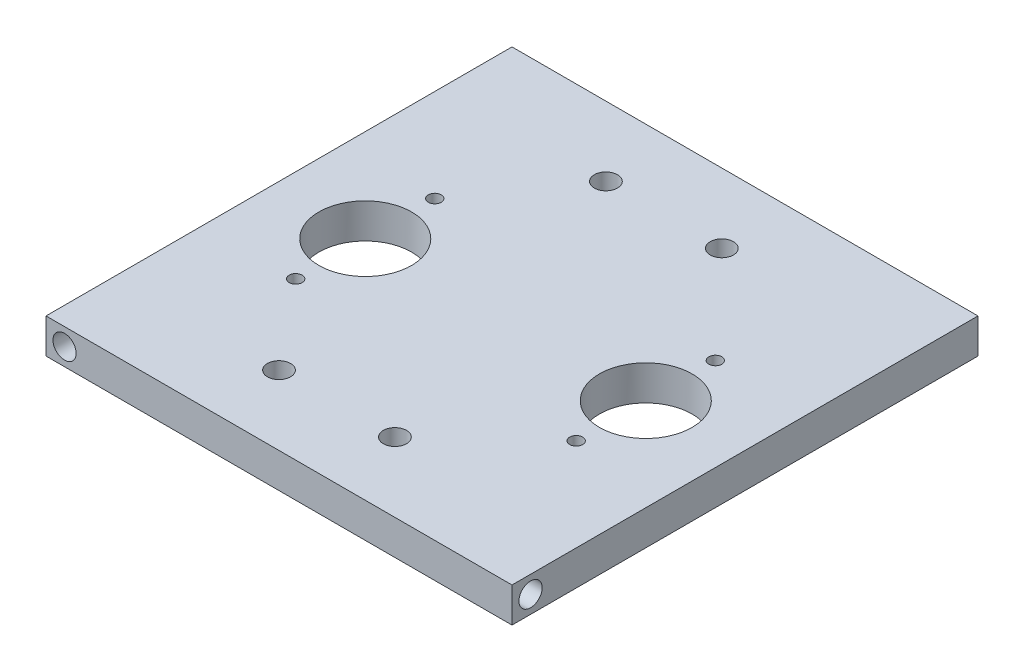
from build123d import *

# Parameters (mm, degrees)
SKETCH1_W                      = 127.635
SKETCH1_H                      = 127.635
MAIN_PLATE_DEPTH               = 9.525
SKETCH2_R                      = 3.175
U_BOLT_HOLE_DEPTH              = 12.7
U_BOLT_PATTERN_COUNT           = 2
U_BOLT_PATTERN_PITCH           = 31.75
U_BOLT_PATTERN_COUNT_DIR2      = 2
U_BOLT_PATTERN_PITCH_DIR2      = 89.535
SKETCH3_R                      = 1.778
RAPTOR_BOLT_HOLE_DEPTH         = 12.7
RAPTOR_BOLT_PATTERN_COUNT      = 2
RAPTOR_BOLT_PATTERN_PITCH      = 38.1
RAPTOR_BOLT_PATTERN_COUNT_DIR2 = 2
RAPTOR_BOLT_PATTERN_PITCH_DIR2 = 76.835
SKETCH4_R                      = 12.7
CO2_CYLINDER_HOLE_DEPTH        = 12.7
CO2_PATTERN_COUNT              = 2
CO2_PATTERN_PITCH              = 76.835
SKETCH5_R                      = 3.175
FRAME_ATTACHMENT_HOLE_1_DEPTH  = 12.7
SKETCH6_R                      = 3.175
FRAME_ATTACHMENT_HOLE_2_DEPTH  = 12.7
SKETCH7_R                      = 3.175
FRAME_ATTACHMENT_HOLE_3_DEPTH  = 12.7
SKETCH8_R                      = 3.175
FRAME_ATTACHMENT_HOLE_4_DEPTH  = 12.7


with BuildPart() as part:
    # Sketch1 → Main Plate (new body)
    with BuildSketch(Plane(origin=(0, 0, 0), x_dir=(1, 0, 0), z_dir=(0, 1, 0))):
        with Locations((63.8175, 63.8175)):
            Rectangle(SKETCH1_W, SKETCH1_H)
    extrude(amount=MAIN_PLATE_DEPTH)

    # Sketch2 → U-Bolt Hole (cut)
    with BuildSketch(Plane(origin=(0, 9.525, 0), x_dir=(1, 0, 0), z_dir=(0, 1, 0))):
        with Locations((44.7675, 108.585)):
            Circle(SKETCH2_R)
    u_bolt_hole = extrude(amount=-U_BOLT_HOLE_DEPTH, mode=Mode.SUBTRACT)

    # U-Bolt Pattern: U-Bolt Hole 2 × 2
    with Locations(*[(i * U_BOLT_PATTERN_PITCH, 0, j * U_BOLT_PATTERN_PITCH_DIR2) for i in range(U_BOLT_PATTERN_COUNT) for j in range(U_BOLT_PATTERN_COUNT_DIR2) if (i, j) != (0, 0)]):
        add(u_bolt_hole, mode=Mode.SUBTRACT)

    # Sketch3 → Raptor Bolt Hole (cut)
    with BuildSketch(Plane(origin=(0, 9.525, 0), x_dir=(1, 0, 0), z_dir=(0, 1, 0))):
        with Locations((25.4, 42.9895)):
            Circle(SKETCH3_R)
    raptor_bolt_hole = extrude(amount=-RAPTOR_BOLT_HOLE_DEPTH, mode=Mode.SUBTRACT)

    # Raptor Bolt Pattern: Raptor Bolt Hole 2 × 2
    with Locations(*[(j * RAPTOR_BOLT_PATTERN_PITCH_DIR2, 0, -i * RAPTOR_BOLT_PATTERN_PITCH) for i in range(RAPTOR_BOLT_PATTERN_COUNT) for j in range(RAPTOR_BOLT_PATTERN_COUNT_DIR2) if (i, j) != (0, 0)]):
        add(raptor_bolt_hole, mode=Mode.SUBTRACT)

    # Sketch4 → Co2 Cylinder Hole (cut)
    with BuildSketch(Plane(origin=(0, 9.525, 0), x_dir=(1, 0, 0), z_dir=(0, 1, 0))):
        with Locations((25.4, 62.0395)):
            Circle(SKETCH4_R)
    co2_cylinder_hole = extrude(amount=-CO2_CYLINDER_HOLE_DEPTH, mode=Mode.SUBTRACT)

    # Co2 Pattern: Co2 Cylinder Hole ×2
    with Locations(*[(i * CO2_PATTERN_PITCH, 0, 0) for i in range(1, CO2_PATTERN_COUNT)]):
        add(co2_cylinder_hole, mode=Mode.SUBTRACT)

    # Sketch5 → Frame attachment hole 1 (cut)
    with BuildSketch(Plane.XY):
        with Locations((5.08, 4.7625)):
            Circle(SKETCH5_R)
    extrude(amount=-FRAME_ATTACHMENT_HOLE_1_DEPTH, mode=Mode.SUBTRACT)

    # Sketch6 → Frame attachment hole 2 (cut)
    with BuildSketch(Plane.ZY):
        with Locations((-122.555, 4.7625)):
            Circle(SKETCH6_R)
    extrude(amount=-FRAME_ATTACHMENT_HOLE_2_DEPTH, mode=Mode.SUBTRACT)

    # Sketch7 → Frame attachment hole 3 (cut)
    with BuildSketch(Plane(origin=(0, 0, -127.635), x_dir=(-1, 0, 0), z_dir=(0, 0, -1))):
        with Locations((-122.555, 4.7625)):
            Circle(SKETCH7_R)
    extrude(amount=-FRAME_ATTACHMENT_HOLE_3_DEPTH, mode=Mode.SUBTRACT)

    # Sketch8 → Frame attachment hole 4 (cut)
    with BuildSketch(Plane(origin=(127.635, 0, 0), x_dir=(0, 0, -1), z_dir=(1, 0, 0))):
        with Locations((5.08, 4.7625)):
            Circle(SKETCH8_R)
    extrude(amount=-FRAME_ATTACHMENT_HOLE_4_DEPTH, mode=Mode.SUBTRACT)


solid = part.part
